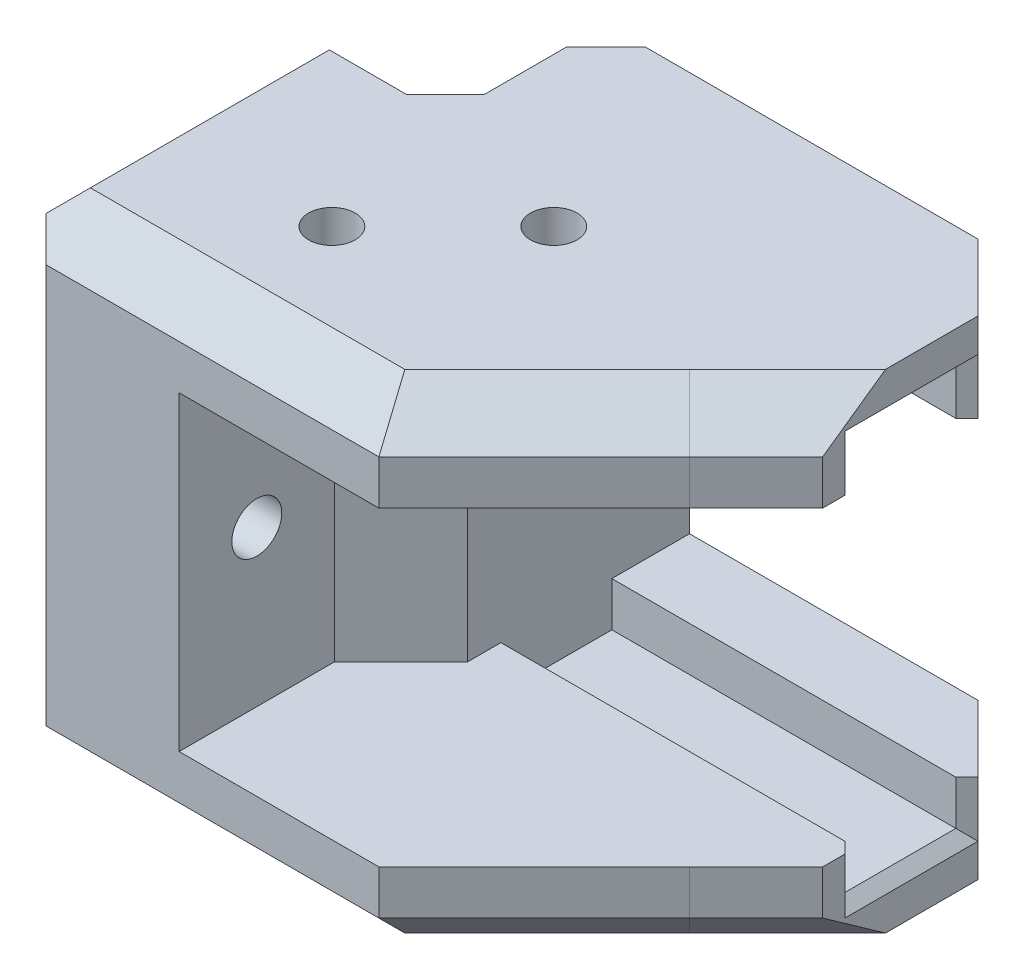
from build123d import *
from build123d.topology import SkipClean

# Parameters (mm, degrees)
SKETCH9_W            = 36
SKETCH9_H            = 36
BOSS_EXTRUDE1_DEPTH  = 40
CHAMFER2_SIZE        = 18
SKETCH10_W           = 36
SKETCH10_H           = 40
BOSS_EXTRUDE2_DEPTH  = 8
SKETCH12_W           = 44
SKETCH12_H           = 40
BOSS_EXTRUDE3_DEPTH  = 8
CHAMFER3_SIZE        = 18
CHAMFER4_SIZE        = 6
SKETCH13_W           = 36.769552622
SKETCH13_H           = 20
CUT_EXTRUDE6_DEPTH   = 39.59798
SKETCH22_R           = 2.1
CUT_EXTRUDE13_DEPTH  = 6
BOSS_EXTRUDE7_DEPTH  = 8
BOSS_EXTRUDE8_DEPTH  = 12
BOSS_EXTRUDE9_DEPTH  = 4
CUT_EXTRUDE14_DEPTH  = 4
CUT_EXTRUDE15_DEPTH  = 4
SKETCH28_W           = 4
SKETCH28_H           = 28
CUT_EXTRUDE16_DEPTH  = 77.210235533
BOSS_EXTRUDE11_DEPTH = 28
SKETCH31_W           = 10
SKETCH31_H           = 36
CUT_EXTRUDE17_DEPTH  = 22
SKETCH32_W           = 44
SKETCH32_H           = 18.026894841
CUT_EXTRUDE18_DEPTH  = 72.888803022
BOSS_EXTRUDE12_DEPTH = 10
BOSS_EXTRUDE13_DEPTH = 10
CHAMFER5_SIZE        = 6
CUT_EXTRUDE19_DEPTH  = 79.409183136
CHAMFER6_SIZE        = 6
SKETCH37_R           = 2.8
CUT_EXTRUDE20_DEPTH  = 7
BOSS_EXTRUDE14_DEPTH = 14
CHAMFER7_SIZE        = 14
CHAMFER8_SIZE        = 4
BOSS_EXTRUDE15_START = 7
SKETCH41_R           = 2.8
BOSS_EXTRUDE15_DEPTH = 7
BOSS_EXTRUDE16_START = 7
SKETCH42_R           = 2.8
BOSS_EXTRUDE16_DEPTH = 7
CHAMFER9_SIZE        = 1
SKETCH43_R           = 2.25
CUT_EXTRUDE21_DEPTH  = 69.381283989
SKETCH44_R           = 4
CUT_EXTRUDE22_DEPTH  = 7
CHAMFER11_SIZE       = 4
CHAMFER12_SIZE       = 3
SKETCH48_R           = 2.1
CUT_EXTRUDE26_DEPTH  = 4
SKETCH49_R           = 2.1
CUT_EXTRUDE27_DEPTH  = 4
CUT_EXTRUDE28_DEPTH  = 79.409183136


with BuildPart() as part:
    # Sketch9 → Boss-Extrude1 (new body)
    with BuildSketch(Plane(origin=(0, 0, 0), x_dir=(1, 0, 0), z_dir=(0, 1, 0))):
        with Locations((18, 18)):
            Rectangle(SKETCH9_W, SKETCH9_H)
    extrude(amount=BOSS_EXTRUDE1_DEPTH)

    # Chamfer2
    chamfer2_edges = [part.edges().sort_by_distance(p)[0] for p in [
        (0, 20, -36),
    ]]
    chamfer(chamfer2_edges, length=CHAMFER2_SIZE)

    # Sketch10 → Boss-Extrude2 (add)
    with BuildSketch(Plane(origin=(36, 0, 0), x_dir=(0, 0, -1), z_dir=(1, 0, 0))):
        with Locations((18, 20)):
            Rectangle(SKETCH10_W, SKETCH10_H)
    extrude(amount=BOSS_EXTRUDE2_DEPTH)

    # Sketch12 → Boss-Extrude3 (add)
    with BuildSketch(Plane.XY):
        with Locations((22, 20)):
            Rectangle(SKETCH12_W, SKETCH12_H)
    extrude(amount=BOSS_EXTRUDE3_DEPTH)

    # Chamfer3
    chamfer3_edges = [part.edges().sort_by_distance(p)[0] for p in [
        (44, 20, -36),
        (0, 20, 8),
    ]]
    chamfer(chamfer3_edges, length=CHAMFER3_SIZE)

    # Chamfer4
    chamfer4_edges = [part.edges().sort_by_distance(p)[0] for p in [
        (44, 20, 8),
    ]]
    chamfer(chamfer4_edges, length=CHAMFER4_SIZE)

    # Sketch13 → Cut-Extrude6 (cut)
    with BuildSketch(Plane(origin=(23, 0, 23), x_dir=(0.7071067811865465, 0, -0.7071067811865487), z_dir=(0.7071067811865487, 0, 0.7071067811865465))):
        with Locations((25.455844123, 22)):
            Rectangle(SKETCH13_W, SKETCH13_H)
    extrude(amount=-CUT_EXTRUDE6_DEPTH, mode=Mode.SUBTRACT)

    # Sketch22 → Cut-Extrude13 (cut)
    with BuildSketch(Plane(origin=(-9, 0, -9), x_dir=(-0.7071067811865487, 0, 0.7071067811865465), z_dir=(-0.7071067811865465, 0, -0.7071067811865487))):
        with Locations((-15.455844123, 36)):
            Circle(SKETCH22_R)
        with Locations((-35.455844123, 36)):
            Circle(SKETCH22_R)
        with Locations((-35.455844123, 4)):
            Circle(SKETCH22_R)
        with Locations((-15.455844123, 4)):
            Circle(SKETCH22_R)
    extrude(amount=-CUT_EXTRUDE13_DEPTH, mode=Mode.SUBTRACT)

    # Sketch23 → Boss-Extrude7 (add)
    with BuildSketch(Plane(origin=(0, 40, 0), x_dir=(1, 0, 0), z_dir=(0, 1, 0))):
        Polygon((26, 36), (44, 36), (44, 18), align=None)
    extrude(amount=-BOSS_EXTRUDE7_DEPTH)

    # Sketch24 → Boss-Extrude8 (add)
    with BuildSketch(Plane(origin=(0, 0, 0), x_dir=(-1, 0, 0), z_dir=(0, -1, 0))):
        Polygon((-44, 18), (-26, 36), (-44, 36), align=None)
    extrude(amount=-BOSS_EXTRUDE8_DEPTH)

    # Sketch25 → Boss-Extrude9 (add)
    with BuildSketch(Plane(origin=(0, 40, 0), x_dir=(1, 0, 0), z_dir=(0, 1, 0))):
        Polygon((18, -8), (38, -8), (44, -2), (44, 36), (18, 36), (0, 18), (0, 10), align=None)
    extrude(amount=BOSS_EXTRUDE9_DEPTH)

    # Sketch26 → Cut-Extrude14 (cut)
    with SkipClean():  # the faces are left unmerged after this step: merging them gives an invalid solid
        with BuildSketch(Plane(origin=(0, 32, 0), x_dir=(-1, 0, 0), z_dir=(0, -1, 0))):
            Polygon((-44, 36), (-44, -2), (-38, -8), (-18, -8), (0, 10), (-26, 36), align=None)
        extrude(amount=-CUT_EXTRUDE14_DEPTH, mode=Mode.SUBTRACT)

    # Sketch27 → Cut-Extrude15 (cut)
    with BuildSketch(Plane(origin=(0, 12, 0), x_dir=(1, 0, 0), z_dir=(0, 1, 0))):
        Polygon((44, -2), (44, 36), (26, 36), (0, 10), (18, -8), (38, -8), align=None)
    extrude(amount=-CUT_EXTRUDE15_DEPTH, mode=Mode.SUBTRACT)

    # Sketch28 → Cut-Extrude16 (cut, through all)
    with BuildSketch(Plane(origin=(0, 0, -36), x_dir=(-1, 0, 0), z_dir=(0, 0, -1))):
        with Locations((-24, 22)):
            Rectangle(SKETCH28_W, SKETCH28_H)
    extrude(amount=-CUT_EXTRUDE16_DEPTH, mode=Mode.SUBTRACT)

    # Sketch30 → Boss-Extrude11 (add)
    with BuildSketch(Plane(origin=(0, 8, 0), x_dir=(1, 0, 0), z_dir=(0, 1, 0))):
        Polygon((0, 10), (22, 10), (22, 32), align=None)
    extrude(amount=BOSS_EXTRUDE11_DEPTH)

    # Sketch31 → Cut-Extrude17 (cut)
    with BuildSketch(Plane(origin=(44, 0, 0), x_dir=(0, 0, -1), z_dir=(1, 0, 0))):
        with Locations((24, 22)):
            Rectangle(SKETCH31_W, SKETCH31_H)
    extrude(amount=-CUT_EXTRUDE17_DEPTH, mode=Mode.SUBTRACT)

    # Sketch32 → Cut-Extrude18 (cut, through all)
    with BuildSketch(Plane(origin=(0, 0, 0), x_dir=(-1, 0, 0), z_dir=(0, -1, 0))):
        with Locations((-22, 0.986552579)):
            Rectangle(SKETCH32_W, SKETCH32_H)
    extrude(amount=-CUT_EXTRUDE18_DEPTH, mode=Mode.SUBTRACT)

    # Sketch33 → Boss-Extrude12 (add)
    with BuildSketch(Plane(origin=(44, 0, 0), x_dir=(0, 0, -1), z_dir=(1, 0, 0))):
        Polygon((10, 8), (10, 0), (36, 0), (36, 8), (29, 8), (29, 4), (19, 4), (19, 8), align=None)
    extrude(amount=BOSS_EXTRUDE12_DEPTH)

    # Sketch35 → Boss-Extrude13 (add)
    with BuildSketch(Plane(origin=(44, 0, 0), x_dir=(0, 0, -1), z_dir=(1, 0, 0))):
        Polygon((10, 44), (10, 36), (19, 36), (19, 40), (29, 40), (29, 36), (36, 36), (36, 44), align=None)
    extrude(amount=BOSS_EXTRUDE13_DEPTH)

    # Chamfer5
    chamfer5_edges = [part.edges().sort_by_distance(p)[0] for p in [
        (54, 4, -10),
        (54, 4, -36),
        (54, 40, -10),
        (54, 40, -36),
    ]]
    chamfer(chamfer5_edges, length=CHAMFER5_SIZE)

    # Sketch36 → Cut-Extrude19 (cut, through all)
    with BuildSketch(Plane(origin=(0, 44, 0), x_dir=(1, 0, 0), z_dir=(0, 1, 0))):
        Polygon((14, 32), (14, 26), (10, 22), (4, 22), align=None)
    extrude(amount=-CUT_EXTRUDE19_DEPTH, mode=Mode.SUBTRACT)

    # Chamfer6
    chamfer6_edges = [part.edges().sort_by_distance(p)[0] for p in [
        (22, 22, -10),
    ]]
    chamfer(chamfer6_edges, length=CHAMFER6_SIZE)

    # Sketch37 → Cut-Extrude20 (cut)
    with BuildSketch(Plane(origin=(22, 0, 0), x_dir=(0, 0, -1), z_dir=(1, 0, 0))):
        with Locations(Location((24, 31, 0), (0, 0, 90))):
            Circle(SKETCH37_R)
        with Locations(Location((24, 13, 0), (0, 0, 90))):
            Circle(SKETCH37_R)
    extrude(amount=-CUT_EXTRUDE20_DEPTH, mode=Mode.SUBTRACT)

    # Sketch39 → Boss-Extrude14 (add)
    with BuildSketch(Plane.XY.offset(-10)):
        Polygon((48, 8), (16, 8), (16, 36), (48, 36), (48, 44), (0, 44), (0, 0), (48, 0), align=None)
    extrude(amount=BOSS_EXTRUDE14_DEPTH)

    # Chamfer7
    chamfer7_edges = [part.edges().sort_by_distance(p)[0] for p in [
        (48, 4, 4),
        (48, 40, 4),
    ]]
    chamfer(chamfer7_edges, length=CHAMFER7_SIZE - 0.0001)  # a hair under: the kernel refuses the full size

    # Chamfer8
    chamfer8_edges = [part.edges().sort_by_distance(p)[0] for p in [
        (17.00005, 0, 4),
        (0, 22, 4),
        (17.00005, 44, 4),
        (41.00005, 0, -2.99995),
        (48, 0, -9.99995),
        (51, 0, -13),
        (41.00005, 44, -2.99995),
        (48, 44, -9.99995),
        (51, 44, -13),
    ]]
    chamfer(chamfer8_edges, length=CHAMFER8_SIZE)

    # Sketch41 → Boss-Extrude15 (add)
    with BuildSketch(Plane(origin=(15, 0, 0), x_dir=(0, 0, -1), z_dir=(1, 0, 0)).offset(BOSS_EXTRUDE15_START)):
        with Locations((24, 31)):
            Circle(SKETCH41_R)
    extrude(amount=-BOSS_EXTRUDE15_DEPTH)

    # Sketch42 → Boss-Extrude16 (add)
    with BuildSketch(Plane(origin=(15, 0, 0), x_dir=(0, 0, -1), z_dir=(1, 0, 0)).offset(BOSS_EXTRUDE16_START)):
        with Locations((24, 13)):
            Circle(SKETCH42_R)
    extrude(amount=-BOSS_EXTRUDE16_DEPTH)

    # Chamfer9
    chamfer9_edges = [part.edges().sort_by_distance(p)[0] for p in [
        (54, 6, -29),
        (54, 4, -24),
        (54, 6, -19),
        (54, 38, -19),
        (54, 40, -24),
        (54, 38, -29),
    ]]
    chamfer(chamfer9_edges, length=CHAMFER9_SIZE - 0.0001)  # a hair under: the kernel refuses the full size

    # Sketch43 → Cut-Extrude21 (cut, through all)
    with BuildSketch(Plane(origin=(16, 0, 0), x_dir=(0, 0, -1), z_dir=(1, 0, 0))):
        with Locations(Location((3, 22, 0), (0, 0, 90))):
            Circle(SKETCH43_R)
    extrude(amount=-CUT_EXTRUDE21_DEPTH, mode=Mode.SUBTRACT)

    # Sketch44 → Cut-Extrude22 (cut)
    with BuildSketch(Plane.ZY):
        with Locations((-3, 22)):
            Circle(SKETCH44_R)
    extrude(amount=-CUT_EXTRUDE22_DEPTH, mode=Mode.SUBTRACT)

    # Chamfer10: read off the stored shape, not the designer's step
    # Chamfer10 outline → Chamfer10 (revolve, cut)
    with BuildSketch(Plane(origin=(0, 22, -3), x_dir=(0, 1, 0), z_dir=(0, 0, -1))):
        Polygon((8, 0), (4, 4), (4, 0), align=None)
    revolve(axis=Axis((0, 22, -3), (1, 0, 0)), mode=Mode.SUBTRACT)

    # Chamfer11
    chamfer11_edges = [part.edges().sort_by_distance(p)[0] for p in [
        (0, 44, -9),
    ]]
    chamfer(chamfer11_edges, length=CHAMFER11_SIZE)

    # Chamfer12
    chamfer12_edges = [part.edges().sort_by_distance(p)[0] for p in [
        (0, 0, -9),
    ]]
    chamfer(chamfer12_edges, length=CHAMFER12_SIZE)

    # Sketch48 → Cut-Extrude26 (cut)
    with BuildSketch(Plane(origin=(0, 0, 0), x_dir=(-1, 0, 0), z_dir=(0, -1, 0))):
        with Locations(Location((-28.025270862, 18.024920623, 0), (0, 0, 90))):
            Circle(SKETCH48_R)
        with Locations(Location((-18.025270862, 8.024920623, 0), (0, 0, 90))):
            Circle(SKETCH48_R)
    extrude(amount=-CUT_EXTRUDE26_DEPTH, mode=Mode.SUBTRACT)

    # Sketch49 → Cut-Extrude27 (cut)
    with BuildSketch(Plane(origin=(0, 44, 0), x_dir=(1, 0, 0), z_dir=(0, 1, 0))):
        with Locations(Location((17.898400733, 7.868441876, 0), (0, 0, 270))):
            Circle(SKETCH49_R)
        with Locations(Location((27.898400733, 17.868441876, 0), (0, 0, 270))):
            Circle(SKETCH49_R)
    extrude(amount=-CUT_EXTRUDE27_DEPTH, mode=Mode.SUBTRACT)

    # Sketch50 → Cut-Extrude28 (cut, through all)
    with BuildSketch(Plane(origin=(0, 0, 0), x_dir=(-1, 0, 0), z_dir=(0, -1, 0))):
        Polygon((-3.535533906, 21.535533906), (-10.928932188, 21.535533906), (-14.464466094, 25.071067812), (-14.464466094, 32.464466094), align=None)
    extrude(amount=-CUT_EXTRUDE28_DEPTH, mode=Mode.SUBTRACT)


solid = part.part
